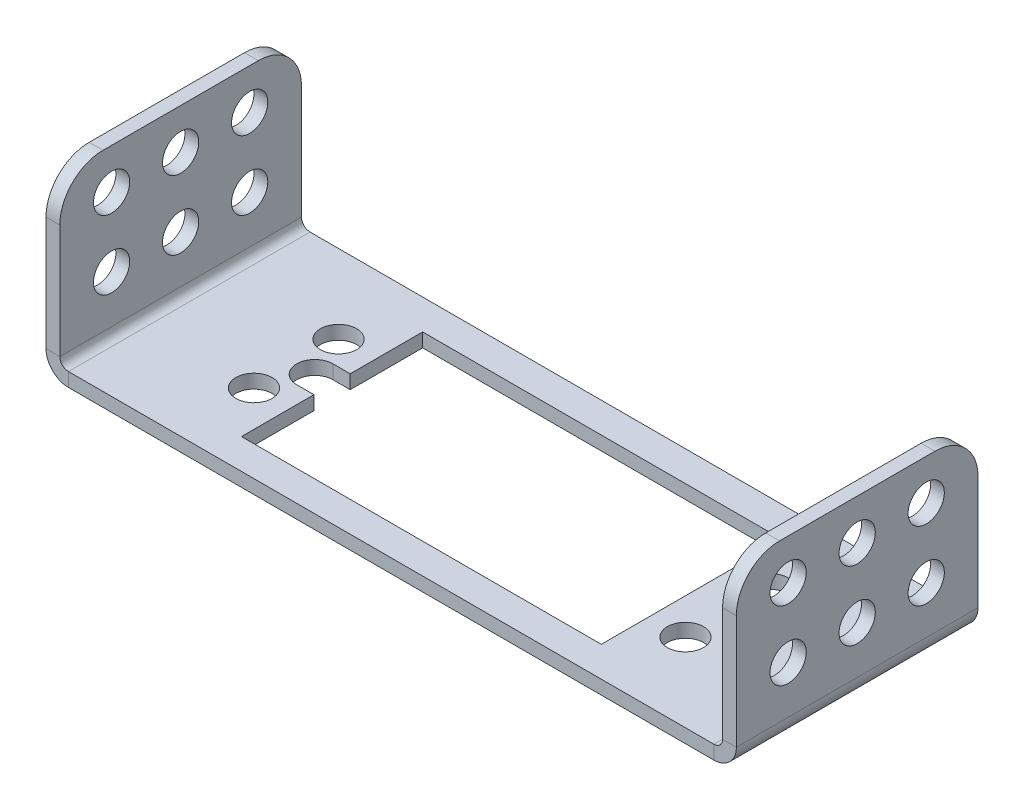
from build123d import *

# Parameters (mm, degrees)
SKETCH1_W                      = 80
SKETCH1_H                      = 28
BOSS_EXTRUDE1_DEPTH            = 1.6
SKETCH2_R                      = 2.1
CUT_EXTRUDE1_DEPTH             = 85.77358079
LPATTERN1_COUNT                = 2
LPATTERN1_PITCH                = 50
LPATTERN1_COUNT_DIR2           = 2
LPATTERN1_PITCH_DIR2           = 9.8
SKETCH15_W                     = 41.7
SKETCH15_H                     = 21
CUT_EXTRUDE3_DEPTH             = 85.77358079
EDGE_FLANGE1_STRIP_W           = 8.4
EDGE_FLANGE1_STRIP_H           = 1.6
EDGE_FLANGE1_STRIP_CUT_DEPTH   = 28
EDGE_FLANGE1_STRIP_2_W         = 8.4
EDGE_FLANGE1_STRIP_2_H         = 1.6
EDGE_FLANGE1_STRIP_CUT_2_DEPTH = 28
EDGE_FLANGE1_DEPTH             = 28
EDGE_FLANGE1_BEND_DEPTH        = 28
FILLET1_R                      = 5
SKETCH14_R                     = 2.1
CUT_EXTRUDE2_DEPTH             = 88.273363634
LPATTERN2_COUNT                = 3
LPATTERN2_PITCH                = 8
LPATTERN2_COUNT_DIR2           = 2
LPATTERN2_PITCH_DIR2           = 8
CUT_EXTRUDE4_DEPTH             = 10


# Sheet-metal steps are written as plain solids
with BuildPart() as part:
    # Sketch1 → Boss-Extrude1 (new body)
    with BuildSketch(Plane(origin=(0, 0, 0), x_dir=(1, 0, 0), z_dir=(0, 1, 0))):
        with Locations((40, -14)):
            Rectangle(SKETCH1_W, SKETCH1_H)
    extrude(amount=BOSS_EXTRUDE1_DEPTH)

    # Sketch2 → Cut-Extrude1 (cut, through all)
    with BuildSketch(Plane(origin=(0, 1.6, 0), x_dir=(1, 0, 0), z_dir=(0, 1, 0))):
        with Locations(Location((15, -9.1, 0), (0, 0, 270))):
            Circle(SKETCH2_R)
    cut_extrude1 = extrude(amount=-CUT_EXTRUDE1_DEPTH, mode=Mode.SUBTRACT)

    # LPattern1: Cut-Extrude1 2 × 2
    with Locations(*[(i * LPATTERN1_PITCH, 0, j * LPATTERN1_PITCH_DIR2) for i in range(LPATTERN1_COUNT) for j in range(LPATTERN1_COUNT_DIR2) if (i, j) != (0, 0)]):
        add(cut_extrude1, mode=Mode.SUBTRACT)

    # Sketch15 → Cut-Extrude3 (cut, through all)
    with BuildSketch(Plane(origin=(0, 1.6, 0), x_dir=(1, 0, 0), z_dir=(0, 1, 0))):
        with Locations((40, -14)):
            Rectangle(SKETCH15_W, SKETCH15_H)
    extrude(amount=-CUT_EXTRUDE3_DEPTH, mode=Mode.SUBTRACT)

    # Edge-Flange1 strip (across the edge) → Edge-Flange1 strip cut (cut)
    with BuildSketch(Plane(origin=(80, 1.6, 28), x_dir=(-1, 0, 0), z_dir=(0, 0, -1))):
        with Locations((-1.6, -0.8)):
            Rectangle(EDGE_FLANGE1_STRIP_W, EDGE_FLANGE1_STRIP_H)
    extrude(amount=EDGE_FLANGE1_STRIP_CUT_DEPTH, mode=Mode.SUBTRACT)

    # Edge-Flange1 strip 2 (across the edge) → Edge-Flange1 strip cut 2 (cut)
    with BuildSketch(Plane(origin=(0, 1.6, 0), x_dir=(1, 0, 0), z_dir=(0, 0, 1))):
        with Locations((-1.6, -0.8)):
            Rectangle(EDGE_FLANGE1_STRIP_2_W, EDGE_FLANGE1_STRIP_2_H)
    extrude(amount=EDGE_FLANGE1_STRIP_CUT_2_DEPTH, mode=Mode.SUBTRACT)

    # Edge-Flange1 section (across the edge) → Edge-Flange1 (add)
    with BuildSketch(Plane(origin=(80, 1.6, 28), x_dir=(-1, 0, 0), z_dir=(0, 0, -1))):
        with BuildLine():
            Line((0, 1), (0, 19.2))
            Line((0, 19.2), (1.6, 19.2))
            Line((1.6, 19.2), (1.6, 1))
            ThreePointArc((1.6, 1), (1.892893219, 0.292893219), (2.6, 0))
            Line((2.6, 0), (2.6, -1.6))
            ThreePointArc((2.6, -1.6), (0.761522369, -0.838477631), (0, 1))
        make_face()
    extrude(amount=EDGE_FLANGE1_DEPTH)

    # Edge-Flange1 section 2 (across the edge) → Edge-Flange1 bend (add)
    with BuildSketch(Plane(origin=(0, 1.6, 0), x_dir=(1, 0, 0), z_dir=(0, 0, 1))):
        with BuildLine():
            Line((0, 1), (0, 19.2))
            Line((0, 19.2), (1.6, 19.2))
            Line((1.6, 19.2), (1.6, 1))
            ThreePointArc((1.6, 1), (1.892893219, 0.292893219), (2.6, 0))
            Line((2.6, 0), (2.6, -1.6))
            ThreePointArc((2.6, -1.6), (0.761522369, -0.838477631), (0, 1))
        make_face()
    extrude(amount=EDGE_FLANGE1_BEND_DEPTH)

    # Fillet1
    fillet1_edges = [part.edges().sort_by_distance(p)[0] for p in [
        (79.2, 20.8, 28),
        (79.2, 20.8, 0),
        (0.8, 20.8, 0),
        (0.8, 20.8, 28),
    ]]
    fillet(fillet1_edges, radius=FILLET1_R)

    # Sketch14 → Cut-Extrude2 (cut, through all)
    with BuildSketch(Plane.ZY):
        with Locations(Location((6, 8.1, 0), (0, 0, 270))):
            Circle(SKETCH14_R)
    cut_extrude2 = extrude(amount=-CUT_EXTRUDE2_DEPTH, mode=Mode.SUBTRACT)

    # LPattern2: Cut-Extrude2 3 × 2
    with Locations(*[(0, j * LPATTERN2_PITCH_DIR2, i * LPATTERN2_PITCH) for i in range(LPATTERN2_COUNT) for j in range(LPATTERN2_COUNT_DIR2) if (i, j) != (0, 0)]):
        add(cut_extrude2, mode=Mode.SUBTRACT)

    # Sketch16 → Cut-Extrude4 (cut)
    with BuildSketch(Plane(origin=(0, 1.6, 0), x_dir=(1, 0, 0), z_dir=(0, 1, 0))):
        with BuildLine():
            Line((21.15, -16.1), (17.15, -16.1))
            ThreePointArc((17.15, -16.1), (15.05, -14), (17.15, -11.9))
            Line((17.15, -11.9), (21.15, -11.9))
            ThreePointArc((21.15, -11.9), (23.25, -14), (21.15, -16.1))
        make_face()
    extrude(amount=-CUT_EXTRUDE4_DEPTH, mode=Mode.SUBTRACT)


solid = part.part
